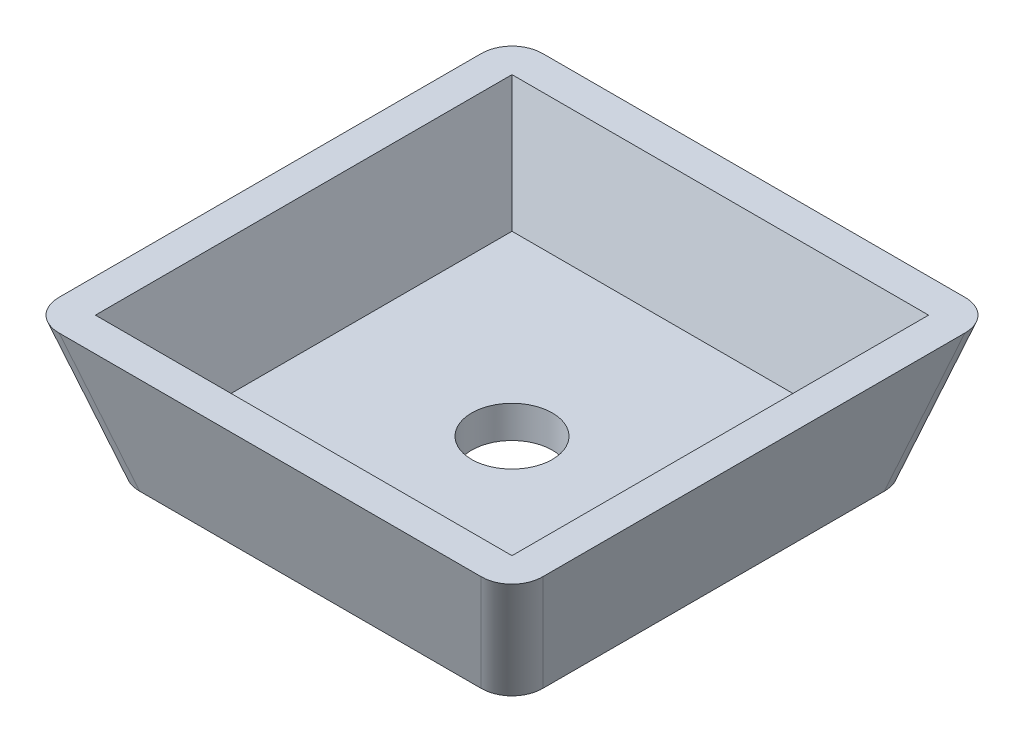
from build123d import *

# Parameters (mm, degrees)
FILLET1_R          = 2
SHELL2_OUTLINE_W   = 22.0070482
SHELL2_OUTLINE_H   = 22.0070482
SHELL2_DEPTH       = 6.5
SHELL2_DRAFT       = -16.3895403
SKETCH5_R          = 2.5
CUT_EXTRUDE1_DEPTH = 10


with BuildPart() as part:
    # Sketch3 → Loft1 section 0
    with BuildSketch(Plane(origin=(0, 8.5, 0), x_dir=(1, 0, 0), z_dir=(0, 1, 0))):
        with BuildLine():
            Line((15, -15), (-15, -15))
            Line((-15, -15), (-15, 15))
            Line((-15, 15), (15, 15))
            Line((15, 15), (15, -15))
        make_face()
    # Sketch2 → Loft1 section 1
    with BuildSketch(Plane(origin=(0, 0, 0), x_dir=(1, 0, 0), z_dir=(0, 1, 0))):
        with BuildLine():
            Line((12.5, -12.5), (-12.5, -12.5))
            Line((-12.5, -12.5), (-12.5, 12.5))
            Line((-12.5, 12.5), (12.5, 12.5))
            Line((12.5, 12.5), (12.5, -12.5))
        make_face()
    loft()

    # Fillet1
    fillet1_edges = [part.edges().sort_by_distance(p)[0] for p in [
        (13.75, 4.25, -13.75),
        (-13.75, 4.25, -13.75),
        (-13.75, 4.25, 13.75),
        (13.75, 4.25, 13.75),
    ]]
    fillet(fillet1_edges, radius=FILLET1_R)


with BuildPart() as shell2_tool:
    # Shell2: read off the stored shape, not the designer's step
    # Shell2 outline → Shell2 (with draft: the straight prism first)
    with BuildSketch(Plane(origin=(0, 2, 0), x_dir=(1, 0, 0), z_dir=(0, 1, 0))):
        Rectangle(SHELL2_OUTLINE_W, SHELL2_OUTLINE_H)
    extrude(amount=SHELL2_DEPTH)
    # Shell2: the draft: its side faces are tilted about the plane it starts from
    shell2_sides = [shell2_tool.faces().sort_by_distance(p)[0] for p in [
        (0, 5.25, -11.0035241),
        (-11.0035241, 5.25, 0),
        (0, 5.25, 11.0035241),
        (11.0035241, 5.25, 0),
    ]]
    draft(shell2_sides, Plane(origin=(0, 2, 0), x_dir=(1, 0, 0), z_dir=(0, 1, 0)), SHELL2_DRAFT)


with BuildPart() as part_1:
    add(part.part)

    # Shell2: cut by shell2_tool
    add(shell2_tool.part, mode=Mode.SUBTRACT)

    # Sketch5 → Cut-Extrude1 (cut)
    with BuildSketch(Plane.XZ):
        with Locations(Location((0, 0, 0), (0, 0, 270))):
            Circle(SKETCH5_R)
    extrude(amount=-CUT_EXTRUDE1_DEPTH, mode=Mode.SUBTRACT)


solid = part_1.part
